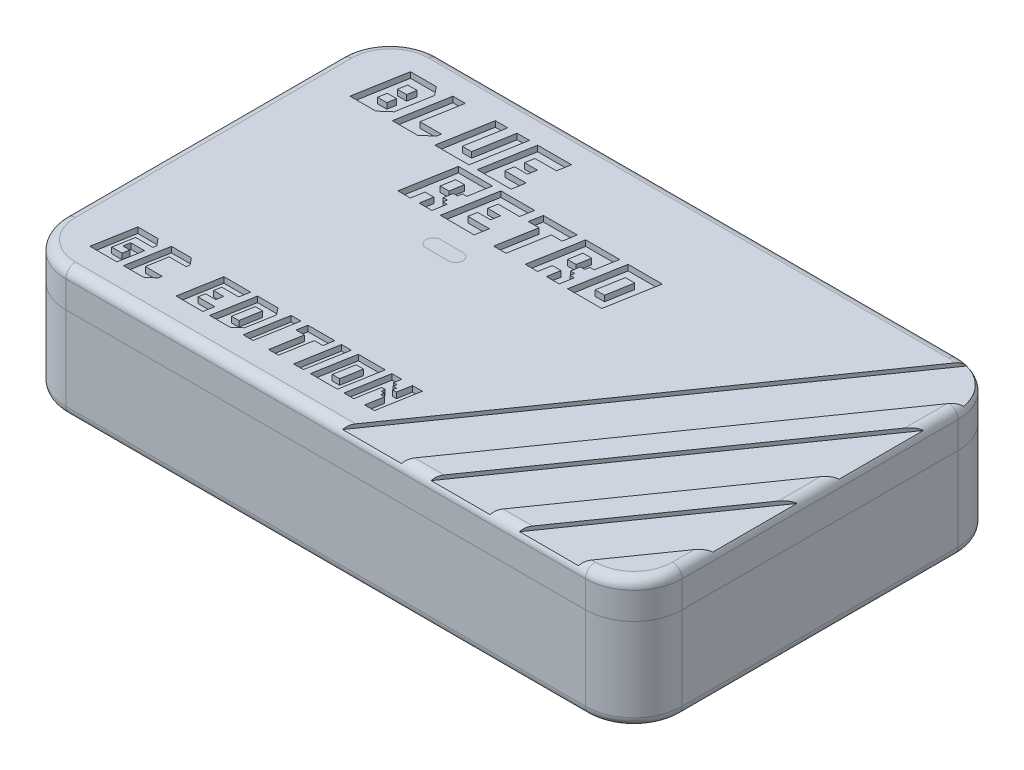
from build123d import *

# Parameters (mm, degrees)
SKETCH1_R                                   = 2
BOSS_EXTRUDE1_DEPTH                         = 0.8
SKETCH2_W                                   = 4
SKETCH2_H                                   = 1.5
BOSS_EXTRUDE2_DEPTH                         = 1
SKETCH3_W                                   = 48.25
SKETCH3_H                                   = 25.72
BOSS_EXTRUDE3_DEPTH                         = 4.15
SKETCH4_W                                   = 2
SKETCH4_H                                   = 5
CUT_EXTRUDE1_DEPTH                          = 0.1
SKETCH9_W                                   = 17.77
SKETCH9_H                                   = 15.77
BOSS_EXTRUDE8_DEPTH                         = 3.2
BOX_SHAPE_DEPTH                             = 4.8
BOX_SHAPE_DEPTH_BACK                        = 12.250000074
SKETCH5_W                                   = 81
SKETCH5_H                                   = 48.970000064
CORNER_FILLETS_R                            = 6.35
TOP_SHELL_T                                 = -2
BOTTOM_SHELL_T                              = -2
PCB_BOSS_HORIZONTAL_DEPTH                   = 1
PCB_BOSS_HORIZONTAL_2_DEPTH                 = 1
PCB_BOSS_VERTICAL_PATTERN_1_COUNT           = 2
PCB_BOSS_VERTICAL_PATTERN_1_ANGLE           = 90
PCB_BOSS_VERTICAL_PATTERN_2_COUNT           = 2
PCB_BOSS_VERTICAL_PATTERN_2_ANGLE           = 90
SKETCH7_R                                   = 2.45
SKETCH7_R_2                                 = 1.95
PCB_BOSS_EDGE_BREAK_DEPTH                   = 90.902188001
SKETCH8_R                                   = 3
SKETCH8_R_2                                 = 2
PCB_TOP_CATCH_DEPTH                         = 3.5
PCB_TOP_CATCH_2_DEPTH                       = 3.5
PCB_TOP_CATCH_3_DEPTH                       = 3.5
PCB_TOP_CATCH_4_DEPTH                       = 3.5
BOSS_NOTCH_FOR_ESP32_REACH                  = 90.547
SKETCH10_W                                  = 3.446348772
SKETCH10_H                                  = 43.18
SHORT_SIDE_SNAPFIT_FEMALE_DEPTH             = 19.05
LONG_SIDE_SNAPFIT_FEMALE_DEPTH              = 19.05
SHORT_SIDE_SNAPFIT_MALE_DEPTH               = 18.415
LONG_SIDE_SNAPFIT_MALE_DEPTH                = 18.415
SKETCH15_R                                  = 1.905
CORD_HOLES_DEPTH                            = 3
CORD_HOLE_FILLET_BOTTOM_R                   = 1
CORD_HOLE_FILLET_TOP_R                      = 1
SKETCH16_W                                  = 5.7277
SKETCH16_H                                  = 2.639081829
SNAPFIT_MALE_REMOVAL_FOR_CORD_HOLES_DEPTH   = 91.007574303
SNAPFIT_FEMALE_REMOVAL_FOR_CORD_HOLES_REACH = 93.023
LED_HOLE_DEPTH                              = 2
TEXT_CUT_DEPTH                              = 0.75
TOP_EDGE_FILLET_R                           = 1.27
R2_DIAG_CUT_LINES_DEPTH                     = 0.500000016
BOTTOM_EDGE_FILLET_R                        = 1.27
SKETCH21_R                                  = 0.75
PLAYER_NUMBER_CUT_DEPTH                     = 1
LED_DIFFUSER_MOCK_DEPTH                     = 1


with BuildPart() as part:
    # Sketch1 → Boss-Extrude1 (new, symmetric)
    with BuildSketch(Plane(origin=(0, 0, 0), x_dir=(1, 0, 0), z_dir=(0, 1, 0))):
        with BuildLine():
            Line((5, 0), (68, 0))
            ThreePointArc((68, 0), (71.535533906, 1.464466094), (73, 5))
            Line((73, 5), (73, 24))
            ThreePointArc((73, 24), (71.535533906, 27.535533906), (68, 29))
            Line((68, 29), (5, 29))
            ThreePointArc((5, 29), (1.464466094, 27.535533906), (0, 24))
            Line((0, 24), (0, 5))
            ThreePointArc((0, 5), (1.464466094, 1.464466094), (5, 0))
        make_face()
        with Locations(Location((4, 4, 0), (0, 0, 270))):
            Circle(SKETCH1_R, mode=Mode.SUBTRACT)
        with Locations(Location((4, 25, 0), (0, 0, 270))):
            Circle(SKETCH1_R, mode=Mode.SUBTRACT)
        with Locations(Location((69, 25, 0), (0, 0, 270))):
            Circle(SKETCH1_R, mode=Mode.SUBTRACT)
        with Locations(Location((69, 4, 0), (0, 0, 270))):
            Circle(SKETCH1_R, mode=Mode.SUBTRACT)
    extrude(amount=BOSS_EXTRUDE1_DEPTH, both=True)

    # Sketch2 → Boss-Extrude2 (add)
    with BuildSketch(Plane(origin=(0, 0.8, 0), x_dir=(1, 0, 0), z_dir=(0, 1, 0))):
        with Locations((25.24, 22.87)):
            Rectangle(SKETCH2_W, SKETCH2_H)
    extrude(amount=BOSS_EXTRUDE2_DEPTH)

    # Sketch3 → Boss-Extrude3 (add)
    with BuildSketch(Plane.XZ.offset(0.8)):
        with Locations((31.67, -14.24)):
            Rectangle(SKETCH3_W, SKETCH3_H)
    extrude(amount=BOSS_EXTRUDE3_DEPTH)

    # Sketch4 → Cut-Extrude1 (cut)
    with BuildSketch(Plane(origin=(0, 0.8, 0), x_dir=(1, 0, 0), z_dir=(0, 1, 0))):
        with Locations((38.02, 14.24)):
            Rectangle(SKETCH4_W, SKETCH4_H)
        with Locations((43.1, 14.24)):
            Rectangle(SKETCH4_W, SKETCH4_H)
        with Locations((48.18, 14.24)):
            Rectangle(SKETCH4_W, SKETCH4_H)
        with Locations((53.26, 14.24)):
            Rectangle(SKETCH4_W, SKETCH4_H)
        with Locations((58.42, 24.4)):
            Rectangle(SKETCH4_W, SKETCH4_H)
        with Locations((58.42, 11.7)):
            Rectangle(SKETCH4_W, SKETCH4_H)
        with Locations((58.42, 18.05)):
            Rectangle(SKETCH4_W, SKETCH4_H)
        with Locations((58.42, 5.35)):
            Rectangle(SKETCH4_W, SKETCH4_H)
        with Locations((63.34, 24.4)):
            Rectangle(SKETCH4_W, SKETCH4_H)
        with Locations((63.34, 11.7)):
            Rectangle(SKETCH4_W, SKETCH4_H)
        with Locations((63.34, 18.05)):
            Rectangle(SKETCH4_W, SKETCH4_H)
        with Locations((63.34, 5.35)):
            Rectangle(SKETCH4_W, SKETCH4_H)
    extrude(amount=-CUT_EXTRUDE1_DEPTH, mode=Mode.SUBTRACT)

    # Sketch9 → Boss-Extrude8 (add)
    with BuildSketch(Plane.XZ.offset(4.95)):
        with Locations((23.43, -14.24)):
            Rectangle(SKETCH9_W, SKETCH9_H)
    extrude(amount=BOSS_EXTRUDE8_DEPTH)


with BuildPart() as body_2:
    # Sketch5 → Box Shape (new, two sides: drawn at the far end of the back side and taken through both)
    with BuildSketch(Plane(origin=(0, 0, 0), x_dir=(1, 0, 0), z_dir=(0, 1, 0)).offset(-BOX_SHAPE_DEPTH_BACK)):
        with Locations((36.5, 20.485000032)):
            Rectangle(SKETCH5_W, SKETCH5_H)
    extrude(amount=BOX_SHAPE_DEPTH + BOX_SHAPE_DEPTH_BACK)

    # Corner Fillets
    corner_fillets_edges = [body_2.edges().sort_by_distance(p)[0] for p in [
        (-4, -3.725000037, -44.970000064),
        (77, -3.725000037, -44.970000064),
        (77, -3.725000037, 4),
        (-4, -3.725000037, 4),
    ]]
    fillet(corner_fillets_edges, radius=CORNER_FILLETS_R)


with BuildPart() as body_3:
    # Top Bottom Split: the piece on the far side of the plane
    add(body_2.part)
    split(bisect_by=Plane.ZX, keep=Keep.BOTTOM)

    # Bottom Shell
    bottom_shell_openings = [body_3.faces().sort_by_distance(p)[0] for p in [
        (36.5, 0, -20.485000032),
    ]]
    offset(amount=BOTTOM_SHELL_T, openings=bottom_shell_openings, kind=Kind.INTERSECTION)


with BuildPart() as body_2_1:
    add(body_2.part)

    # Top Bottom Split
    split(bisect_by=Plane.ZX, keep=Keep.TOP)

    # Top Shell
    top_shell_openings = [body_2_1.faces().sort_by_distance(p)[0] for p in [
        (36.5, 0, -20.485000032),
    ]]
    offset(amount=TOP_SHELL_T, openings=top_shell_openings, kind=Kind.INTERSECTION)


with BuildPart() as body_4:
    # Sketch6 → PCB Boss Horizontal (new, symmetric)
    with BuildSketch(Plane.XY.offset(-4.000000128)):
        Polygon((71.75, -0.8), (74.715, -10.250000074), (63.285, -10.250000074), (66.25, -0.8), (67.25, -0.8), (67.25, 1.8), (70.75, 1.8), (70.75, -0.8), align=None)
    extrude(amount=PCB_BOSS_HORIZONTAL_DEPTH, both=True)


with BuildPart() as body_5:
    # Sketch6 → PCB Boss Horizontal 2 (new, symmetric)
    with BuildSketch(Plane.XY.offset(-4.000000128)):
        Polygon((2.25, -0.8), (1.25, -0.8), (-1.715, -10.250000074), (9.715, -10.250000074), (6.75, -0.8), (5.75, -0.8), (5.75, 1.8), (2.25, 1.8), align=None)
    extrude(amount=PCB_BOSS_HORIZONTAL_2_DEPTH, both=True)


with BuildPart() as pcb_boss_vertical_pattern_1_1:
    # PCB Boss Vertical Pattern 1: pattern copy
    add(body_4.part.rotate(Axis((69, 0, -4), (0, 1, 0)), 1 * PCB_BOSS_VERTICAL_PATTERN_1_ANGLE / (PCB_BOSS_VERTICAL_PATTERN_1_COUNT - 1)))


with BuildPart() as pcb_boss_vertical_pattern_2_1:
    # PCB Boss Vertical Pattern 2: pattern copy
    add(body_5.part.rotate(Axis((4, 0, -4), (0, 1, 0)), 1 * PCB_BOSS_VERTICAL_PATTERN_2_ANGLE / (PCB_BOSS_VERTICAL_PATTERN_2_COUNT - 1)))


with BuildPart() as body_8:
    # PCB Boss Mirror: mirrored copy
    add(pcb_boss_vertical_pattern_1_1.part.mirror(Plane(origin=(0, 0, -14.5), x_dir=(1, 0, 0), z_dir=(0, 0, -1))))


with BuildPart() as body_9:
    # PCB Boss Mirror 2: mirrored copy
    add(body_4.part.mirror(Plane(origin=(0, 0, -14.5), x_dir=(1, 0, 0), z_dir=(0, 0, -1))))


with BuildPart() as body_10:
    # PCB Boss Mirror 3: mirrored copy
    add(pcb_boss_vertical_pattern_2_1.part.mirror(Plane(origin=(0, 0, -14.5), x_dir=(1, 0, 0), z_dir=(0, 0, -1))))


with BuildPart() as body_11:
    # PCB Boss Mirror 4: mirrored copy
    add(body_5.part.mirror(Plane(origin=(0, 0, -14.5), x_dir=(1, 0, 0), z_dir=(0, 0, -1))))


with BuildPart() as body_4_1:
    add(body_4.part)

    # Bottom Combine: union body 5, PCB Boss Vertical Pattern 2_1, PCB Boss Vertical Pattern 1_1, body 3, body 9, body 8, body 11, body 10
    add(body_5.part)
    add(pcb_boss_vertical_pattern_2_1.part)
    add(pcb_boss_vertical_pattern_1_1.part)
    add(body_3.part)
    add(body_9.part)
    add(body_8.part)
    add(body_11.part)
    add(body_10.part)

    # Sketch7 → PCB Boss Edge Break (cut, through all)
    # profile 1 of 4: a face of its own
    with BuildSketch(Plane(origin=(0, -0.8, 0), x_dir=(1, 0, 0), z_dir=(0, 1, 0))):
        with Locations((69, 25)):
            Circle(SKETCH7_R)
        with Locations((69, 25)):
            Circle(SKETCH7_R_2, mode=Mode.SUBTRACT)
    # profile 2 of 4: a face of its own
    with BuildSketch(Plane(origin=(0, -0.8, 0), x_dir=(1, 0, 0), z_dir=(0, 1, 0))):
        with Locations((69, 4)):
            Circle(SKETCH7_R)
        with Locations((69, 4)):
            Circle(SKETCH7_R_2, mode=Mode.SUBTRACT)
    # profile 3 of 4: a face of its own
    with BuildSketch(Plane(origin=(0, -0.8, 0), x_dir=(1, 0, 0), z_dir=(0, 1, 0))):
        with Locations((4, 4)):
            Circle(SKETCH7_R)
        with Locations((4, 4)):
            Circle(SKETCH7_R_2, mode=Mode.SUBTRACT)
    # profile 4 of 4: a face of its own
    with BuildSketch(Plane(origin=(0, -0.8, 0), x_dir=(1, 0, 0), z_dir=(0, 1, 0))):
        with Locations((4, 25)):
            Circle(SKETCH7_R)
        with Locations((4, 25)):
            Circle(SKETCH7_R_2, mode=Mode.SUBTRACT)
    extrude(amount=PCB_BOSS_EDGE_BREAK_DEPTH, mode=Mode.SUBTRACT)

    # Boss Notch for ESP32: up to this face of the body (flat: up to its plane)
    boss_notch_for_esp32_end = Plane(body_4_1.part.faces().sort_by_distance((6.654009501, -5.8812231, -25.999999872))[0])
    # Sketch10 → Boss Notch for ESP32 (cut, up to the picked face)
    with BuildSketch(Plane.XY.offset(-3.000000128), mode=Mode.PRIVATE) as boss_notch_for_esp32_sk1:
        with Locations((64.231825614, 15.39)):
            Rectangle(SKETCH10_W, SKETCH10_H)
    boss_notch_for_esp32_tool1 = split(extrude(boss_notch_for_esp32_sk1.sketch, amount=-BOSS_NOTCH_FOR_ESP32_REACH, mode=Mode.PRIVATE), bisect_by=boss_notch_for_esp32_end, keep=Keep.BOTH, mode=Mode.PRIVATE)
    # Sketch10 → Boss Notch for ESP32 (cut, up to the picked face)
    with BuildSketch(Plane.XY.offset(-3.000000128), mode=Mode.PRIVATE) as boss_notch_for_esp32_sk2:
        with Locations((8.768174386, 15.39)):
            Rectangle(SKETCH10_W, SKETCH10_H)
    boss_notch_for_esp32_tool2 = split(extrude(boss_notch_for_esp32_sk2.sketch, amount=-BOSS_NOTCH_FOR_ESP32_REACH, mode=Mode.PRIVATE), bisect_by=boss_notch_for_esp32_end, keep=Keep.BOTH, mode=Mode.PRIVATE)
    add(boss_notch_for_esp32_tool1.solids().sort_by(Axis((64.231826, 15.39, -3), (0, 0, -1)))[0], mode=Mode.SUBTRACT)
    add(boss_notch_for_esp32_tool2.solids().sort_by(Axis((8.768174, 15.39, -3), (0, 0, -1)))[0], mode=Mode.SUBTRACT)

    # Sketch11 → Short Side Snapfit Female (cut, symmetric)
    with BuildSketch(Plane(origin=(0, 0, -20.485000032), x_dir=(-1, 0, 0), z_dir=(0, 0, -1))):
        with BuildLine():
            Line((-75, 0), (-75, -3))
            Line((-75, -3), (-75.25, -3))
            ThreePointArc((-75.25, -3), (-75.999742994, -2.269632711), (-75.289251967, -1.501027849))
            Line((-75.289251967, -1.501027849), (-75.367917503, 0))
            Line((-75.367917503, 0), (-75, 0))
        make_face()
    short_side_snapfit_female = extrude(amount=SHORT_SIDE_SNAPFIT_FEMALE_DEPTH, both=True, mode=Mode.SUBTRACT)

    # Short Side Snapfit Mirror: Short Side Snapfit Female across plane
    add(short_side_snapfit_female.mirror(Plane.ZY.offset(-36.5)), mode=Mode.SUBTRACT)

    # Sketch12 → Long Side Snapfit Female (cut, symmetric)
    with BuildSketch(Plane.ZY.offset(-36.5)):
        with BuildLine():
            Line((2.367449648, 0), (2, 0))
            Line((2, 0), (2, -3))
            Line((2, -3), (2.25, -3))
            ThreePointArc((2.25, -3), (2.999749072, -2.269399183), (2.288785386, -1.501003542))
            Line((2.288785386, -1.501003542), (2.367449648, 0))
        make_face()
    long_side_snapfit_female = extrude(amount=LONG_SIDE_SNAPFIT_FEMALE_DEPTH, both=True, mode=Mode.SUBTRACT)

    # Long Side Snapfit Female Mirror: Long Side Snapfit Female across plane
    add(long_side_snapfit_female.mirror(Plane(origin=(0, 0, -20.485000032), x_dir=(1, 0, 0), z_dir=(0, 0, -1))), mode=Mode.SUBTRACT)


with BuildPart() as body_4_2:
    # Sketch8 → PCB Top Catch (new body)
    with BuildSketch(Plane(origin=(0, 0.8, 0), x_dir=(1, 0, 0), z_dir=(0, 1, 0))):
        with Locations(Location((69, 4, 0), (0, 0, 270))):
            Circle(SKETCH8_R)
        with Locations(Location((69, 4, 0), (0, 0, 270))):
            Circle(SKETCH8_R_2, mode=Mode.SUBTRACT)
    extrude(amount=PCB_TOP_CATCH_DEPTH)


with BuildPart() as body_5_2:
    # Sketch8 → PCB Top Catch 2 (new body)
    with BuildSketch(Plane(origin=(0, 0.8, 0), x_dir=(1, 0, 0), z_dir=(0, 1, 0))):
        with Locations(Location((69, 25, 0), (0, 0, 270))):
            Circle(SKETCH8_R)
        with Locations(Location((69, 25, 0), (0, 0, 270))):
            Circle(SKETCH8_R_2, mode=Mode.SUBTRACT)
    extrude(amount=PCB_TOP_CATCH_2_DEPTH)


with BuildPart() as body_6:
    # Sketch8 → PCB Top Catch 3 (new body)
    with BuildSketch(Plane(origin=(0, 0.8, 0), x_dir=(1, 0, 0), z_dir=(0, 1, 0))):
        with Locations(Location((4, 25, 0), (0, 0, 270))):
            Circle(SKETCH8_R)
        with Locations(Location((4, 25, 0), (0, 0, 270))):
            Circle(SKETCH8_R_2, mode=Mode.SUBTRACT)
    extrude(amount=PCB_TOP_CATCH_3_DEPTH)


with BuildPart() as body_7:
    # Sketch8 → PCB Top Catch 4 (new body)
    with BuildSketch(Plane(origin=(0, 0.8, 0), x_dir=(1, 0, 0), z_dir=(0, 1, 0))):
        with Locations(Location((4, 4, 0), (0, 0, 270))):
            Circle(SKETCH8_R)
        with Locations(Location((4, 4, 0), (0, 0, 270))):
            Circle(SKETCH8_R_2, mode=Mode.SUBTRACT)
    extrude(amount=PCB_TOP_CATCH_4_DEPTH)

    # Top Combine: union body 4 2, body 5 2, body 6, body 2
    add(body_4_2.part)
    add(body_5_2.part)
    add(body_6.part)
    add(body_2_1.part)


with BuildPart() as body_4_3:
    # Sketch13 → Short Side Snapfit Male (new, symmetric)
    with BuildSketch(Plane(origin=(0, 0, -20.485000032), x_dir=(-1, 0, 0), z_dir=(0, 0, -1))):
        with BuildLine():
            Line((-73.311386027, 2.8), (-75.317986027, 2.8))
            Line((-75.317986027, 2.8), (-75.317986027, 0.002616798))
            Line((-75.317986027, 0.002616798), (-75.236610116, -1.550128075))
            ThreePointArc((-75.236610116, -1.550128075), (-75.94996798, -2.243304752), (-75.25, -2.95))
            Line((-75.25, -2.95), (-73.98, -2.95))
            Line((-73.98, -2.95), (-73.311386027, 2.8))
        make_face()
    extrude(amount=SHORT_SIDE_SNAPFIT_MALE_DEPTH, both=True)


with BuildPart() as body_5_3:
    # Short Side Snapfit Male Mirror: mirrored copy
    add(body_4_3.part.mirror(Plane.ZY.offset(-36.5)))


with BuildPart() as body_6_2:
    # Sketch14 → Long Side Snapfit Male (new, symmetric)
    with BuildSketch(Plane.ZY.offset(-36.5)):
        with BuildLine():
            Line((0.98, -2.95), (0.310918171, 2.8))
            Line((0.310918171, 2.8), (2.317518171, 2.8))
            Line((2.317518171, 2.8), (2.317518171, 0.002616798))
            Line((2.317518171, 0.002616798), (2.236141783, -1.550137192))
            ThreePointArc((2.236141783, -1.550137192), (2.949965701, -2.243070552), (2.25, -2.95))
            Line((2.25, -2.95), (0.98, -2.95))
        make_face()
    extrude(amount=LONG_SIDE_SNAPFIT_MALE_DEPTH, both=True)


with BuildPart() as body_7_2:
    # Long Side Snapfit Male Mirror: mirrored copy
    add(body_6_2.part.mirror(Plane(origin=(0, 0, -20.485000032), x_dir=(1, 0, 0), z_dir=(0, 0, -1))))


with BuildPart() as body_6_2_1:
    add(body_6_2.part)

    # Top Combine 2: union body 5 3, body 4 3, body 7, body 7 2
    add(body_5_3.part)
    add(body_4_3.part)
    add(body_7.part)
    add(body_7_2.part)


with BuildPart() as cord_holes_tool:
    # Sketch15 → Cord Holes (new body)
    with BuildSketch(Plane(origin=(0, 0, -44.970000064), x_dir=(-1, 0, 0), z_dir=(0, 0, -1))):
        with Locations((-60.3125, 0)):
            Circle(SKETCH15_R)
        with Locations((-44.4375, 0)):
            Circle(SKETCH15_R)
        with Locations((-28.5625, 0)):
            Circle(SKETCH15_R)
        with Locations((-12.6875, 0)):
            Circle(SKETCH15_R)
    extrude(amount=-CORD_HOLES_DEPTH)


with BuildPart() as body_4_4:
    add(body_4_1.part)

    # Cord Holes: cut by cord_holes_tool
    add(cord_holes_tool.part, mode=Mode.SUBTRACT)

    # Cord Hole Fillet Bottom
    cord_hole_fillet_bottom_edges = [body_4_4.edges().sort_by_distance(p)[0] for p in [
        (60.3125, -1.905, -44.970000064),
        (44.4375, -1.905, -44.970000064),
        (28.5625, -1.905, -44.970000064),
        (12.6875, -1.905, -44.970000064),
    ]]
    fillet(cord_hole_fillet_bottom_edges, radius=CORD_HOLE_FILLET_BOTTOM_R)


with BuildPart() as body_6_2_2:
    add(body_6_2_1.part)

    # Cord Holes: cut by cord_holes_tool
    add(cord_holes_tool.part, mode=Mode.SUBTRACT)

    # Cord Hole Fillet Top
    cord_hole_fillet_top_edges = [body_6_2_2.edges().sort_by_distance(p)[0] for p in [
        (60.3125, 1.905, -44.970000064),
        (44.4375, 1.905, -44.970000064),
        (28.5625, 1.905, -44.970000064),
        (12.6875, 1.905, -44.970000064),
    ]]
    fillet(cord_hole_fillet_top_edges, radius=CORD_HOLE_FILLET_TOP_R)

    # Sketch16 → Snapfit Male Removal for Cord Holes (cut, through all)
    with BuildSketch(Plane.XZ):
        with Locations((44.43115, -42.600459149)):
            Rectangle(SKETCH16_W, SKETCH16_H)
        with Locations((28.56885, -42.600459149)):
            Rectangle(SKETCH16_W, SKETCH16_H)
    extrude(amount=SNAPFIT_MALE_REMOVAL_FOR_CORD_HOLES_DEPTH, mode=Mode.SUBTRACT)

    # Sketch18 → LED Hole (cut)
    with BuildSketch(Plane(origin=(0, 4.8, 0), x_dir=(1, 0, 0), z_dir=(0, 1, 0))):
        with BuildLine():
            Line((23.761454304, 23.817187834), (26.718545696, 23.817187834))
            ThreePointArc((26.718545696, 23.817187834), (27.66573353, 22.87), (26.718545696, 21.922812166))
            Line((26.718545696, 21.922812166), (23.761454304, 21.922812166))
            ThreePointArc((23.761454304, 21.922812166), (22.81426647, 22.87), (23.761454304, 23.817187834))
        make_face()
    extrude(amount=-LED_HOLE_DEPTH, mode=Mode.SUBTRACT)

    # Sketch20 → Text Cut (cut)
    # profile 1 of 18: a face of its own
    with BuildSketch(Plane(origin=(0, 4.8, 0), x_dir=(1, 0, 0), z_dir=(0, 1, 0))):
        Polygon((6.184089057, 35.313550471), (6.979195308, 39.82297185), (6.53407372, 40.385836725), (6.541530377, 40.385836725), (6.088953221, 40.9487016), (2.688902699, 40.9487016), (1.496522743, 34.186155093), (4.896573265, 34.186155093), align=None)
        Polygon((3.620549114, 36.970449128), (4.843139153, 36.970449128), (4.650385925, 35.87725742), (3.427795885, 35.87725742), align=None, mode=Mode.SUBTRACT)
        Polygon((5.040612571, 38.090413994), (3.818022532, 38.090413994), (4.022904675, 39.252396498), (5.245494715, 39.252396498), align=None, mode=Mode.SUBTRACT)
    # profile 2 of 18: a face of its own
    with BuildSketch(Plane(origin=(0, 4.8, 0), x_dir=(1, 0, 0), z_dir=(0, 1, 0))):
        Polygon((11.726773932, 35.316993933), (11.826018826, 35.879858808), (9.003983974, 35.879858808), (9.898449502, 40.952794319), (8.265353323, 40.952794319), (7.071793592, 34.183553705), (10.401194874, 34.183553705), align=None)
    # profile 3 of 18: a face of its own
    with BuildSketch(Plane(origin=(0, 4.8, 0), x_dir=(1, 0, 0), z_dir=(0, 1, 0))):
        Polygon((16.69676901, 40.952794319), (15.801844862, 35.87725742), (14.579254823, 35.87725742), (15.474178971, 40.952794319), (13.841082792, 40.952794319), (12.64798168, 34.186155093), (17.136764078, 34.186155093), (18.329865189, 40.952794319), align=None)
    # profile 4 of 18: a face of its own
    with BuildSketch(Plane(origin=(0, 4.8, 0), x_dir=(1, 0, 0), z_dir=(0, 1, 0))):
        Polygon((22.969767286, 35.879858808), (20.155442911, 35.879858808), (20.34773752, 36.970449128), (22.036332145, 36.970449128), (22.233805563, 38.090413994), (20.545210938, 38.090413994), (20.750551701, 39.254997885), (23.564876076, 39.254997885), (23.863053039, 40.946100213), (19.415632485, 40.946100213), (18.223252529, 34.183553705), (22.670673083, 34.183553705), align=None)
    # profile 5 of 18: a face of its own
    with BuildSketch(Plane(origin=(0, 4.8, 0), x_dir=(1, 0, 0), z_dir=(0, 1, 0))):
        Polygon((16.61768545, 33.326100213), (15.425764114, 26.566155093), (17.058860293, 26.566155093), (17.348383394, 28.208174205), (18.499581251, 28.208174205), (18.210058149, 26.566155093), (19.898001338, 26.566155093), (20.196178301, 28.25725742), (19.633313426, 28.25725742), (19.724506874, 28.774457486), (19.161641999, 28.774457486), (19.358602329, 29.891509408), (19.921467204, 29.891509408), (20.023454014, 30.469924873), (20.586318889, 30.469924873), (21.089922674, 33.326100213), align=None)
        Polygon((17.646560357, 29.899276533), (17.952604666, 31.634997885), (19.103802523, 31.634997885), (18.797758214, 29.899276533), align=None, mode=Mode.SUBTRACT)
    # profile 6 of 18: a face of its own
    with BuildSketch(Plane(origin=(0, 4.8, 0), x_dir=(1, 0, 0), z_dir=(0, 1, 0))):
        Polygon((25.747549719, 28.259858808), (22.933225345, 28.259858808), (23.125519953, 29.350449128), (24.814114578, 29.350449128), (25.011587996, 30.470413994), (23.322993371, 30.470413994), (23.528334135, 31.634997885), (26.342658509, 31.634997885), (26.640835473, 33.326100213), (22.193414919, 33.326100213), (21.001034962, 26.563553705), (25.448455516, 26.563553705), align=None)
    # profile 7 of 18: a face of its own
    with BuildSketch(Plane(origin=(0, 4.8, 0), x_dir=(1, 0, 0), z_dir=(0, 1, 0))):
        Polygon((32.241101647, 33.326100213), (27.785969525, 33.326100213), (27.487792562, 31.634997885), (28.898809989, 31.634997885), (28.00388584, 26.559460986), (29.636983109, 26.559460986), (30.531907257, 31.634997885), (31.942924683, 31.634997885), align=None)
    # profile 8 of 18: a face of its own
    with BuildSketch(Plane(origin=(0, 4.8, 0), x_dir=(1, 0, 0), z_dir=(0, 1, 0))):
        Polygon((33.344873856, 33.326100213), (32.152952519, 26.566155093), (33.786048699, 26.566155093), (34.0755718, 28.208174205), (35.226769657, 28.208174205), (34.937246555, 26.566155093), (36.625189744, 26.566155093), (36.923366707, 28.25725742), (36.360501832, 28.25725742), (36.45169528, 28.774457486), (35.888830405, 28.774457486), (36.085790735, 29.891509408), (36.64865561, 29.891509408), (36.750642419, 30.469924873), (37.313507294, 30.469924873), (37.81711108, 33.326100213), align=None)
        Polygon((34.373748763, 29.899276533), (34.679793072, 31.634997885), (35.830990928, 31.634997885), (35.52494662, 29.899276533), align=None, mode=Mode.SUBTRACT)
    # profile 9 of 18: a face of its own
    with BuildSketch(Plane(origin=(0, 4.8, 0), x_dir=(1, 0, 0), z_dir=(0, 1, 0))):
        Polygon((38.920603324, 33.326100213), (37.728681988, 26.566155093), (42.217464386, 26.566155093), (43.409385722, 33.326100213), align=None)
        Polygon((40.25552254, 31.634997885), (41.47811258, 31.634997885), (40.88254517, 28.25725742), (39.65995513, 28.25725742), align=None, mode=Mode.SUBTRACT)
    # profile 10 of 18: a face of its own
    with BuildSketch(Plane(origin=(0, 4.8, 0), x_dir=(1, 0, 0), z_dir=(0, 1, 0))):
        Polygon((5.590772397, 3.099702695), (3.78854536, 3.099702695), (3.632212237, 2.213063843), (4.543236556, 2.213063843), (4.39064025, 1.347620407), (3.024108084, 1.347620407), (3.49559895, 4.021664942), (5.753333835, 4.021664942), (5.832018272, 4.467926044), (5.098187879, 5.360454285), (2.438787904, 5.360454285), (1.495183513, 0.008831064), (5.045786206, 0.008831064), align=None)
    # profile 11 of 18: a face of its own
    with BuildSketch(Plane(origin=(0, 4.8, 0), x_dir=(1, 0, 0), z_dir=(0, 1, 0))):
        Polygon((9.587186532, 0.899304185), (9.666234044, 1.347620407), (7.438227247, 1.347620407), (7.909355039, 4.01960551), (10.137361836, 4.01960551), (10.215930711, 4.465206869), (9.482942028, 5.362513716), (6.853270141, 5.362513716), (5.909302676, 0.008831064), (8.538974562, 0.008831064), align=None)
    # profile 12 of 18: a face of its own
    with BuildSketch(Plane(origin=(0, 4.8, 0), x_dir=(1, 0, 0), z_dir=(0, 1, 0))):
        Polygon((16.573195859, 1.349679839), (14.345189062, 1.349679839), (14.497422294, 2.213063843), (15.834226372, 2.213063843), (15.990559495, 3.099702695), (14.653755416, 3.099702695), (14.816316854, 4.021664942), (17.044323651, 4.021664942), (17.280380413, 5.360454285), (13.759505808, 5.360454285), (12.815538343, 0.006771632), (16.336412948, 0.006771632), align=None)
    # profile 13 of 18: a face of its own
    with BuildSketch(Plane(origin=(0, 4.8, 0), x_dir=(1, 0, 0), z_dir=(0, 1, 0))):
        Polygon((20.941010578, 0.901352406), (21.569393407, 4.465206869), (20.865694708, 5.362513716), (18.173988045, 5.362513716), (17.23002058, 0.008831064), (19.921727243, 0.008831064), align=None)
        Polygon((19.230072943, 4.01960551), (20.197956724, 4.01960551), (19.726828932, 1.347620407), (18.758945151, 1.347620407), align=None, mode=Mode.SUBTRACT)
    # profile 14 of 18: a face of its own
    with BuildSketch(Plane(origin=(0, 4.8, 0), x_dir=(1, 0, 0), z_dir=(0, 1, 0))):
        Polygon((22.588678122, 5.365753786), (21.643205754, 0.003531563), (22.936073562, 0.003531563), (23.88154593, 5.365753786), align=None)
    # profile 15 of 18: a face of its own
    with BuildSketch(Plane(origin=(0, 4.8, 0), x_dir=(1, 0, 0), z_dir=(0, 1, 0))):
        Polygon((28.337929152, 5.360454285), (24.810949556, 5.360454285), (24.574892794, 4.021664942), (25.691948256, 4.021664942), (24.983466639, 0.003531563), (26.27633531, 0.003531563), (26.984816927, 4.021664942), (28.10187239, 4.021664942), align=None)
    # profile 16 of 18: a face of its own
    with BuildSketch(Plane(origin=(0, 4.8, 0), x_dir=(1, 0, 0), z_dir=(0, 1, 0))):
        Polygon((29.212682806, 5.365753786), (28.267210438, 0.003531563), (29.560078247, 0.003531563), (30.505550615, 5.365753786), align=None)
    # profile 17 of 18: a face of its own
    with BuildSketch(Plane(origin=(0, 4.8, 0), x_dir=(1, 0, 0), z_dir=(0, 1, 0))):
        Polygon((31.42163434, 5.360454285), (30.478029949, 0.008831064), (34.031649347, 0.008831064), (34.975253738, 5.360454285), align=None)
        Polygon((32.478445386, 4.021664942), (33.446329167, 4.021664942), (32.974838301, 1.347620407), (32.00695452, 1.347620407), align=None, mode=Mode.SUBTRACT)
    # profile 18 of 18: a face of its own
    with BuildSketch(Plane(origin=(0, 4.8, 0), x_dir=(1, 0, 0), z_dir=(0, 1, 0))):
        Polygon((38.548497762, 5.359568591), (38.230162042, 3.554135119), (37.714429614, 3.554135119), (37.794787987, 4.009886165), (37.349701485, 4.009886165), (37.42838851, 4.456154166), (36.969174031, 4.456154166), (37.1295553, 5.365753786), (35.836687491, 5.365753786), (34.891215123, 0.003531563), (36.184082931, 0.003531563), (36.733117268, 3.117363961), (37.192331748, 3.117363961), (37.112205363, 2.6629324), (37.557291864, 2.6629324), (37.480934205, 2.229872187), (37.996666633, 2.229872187), (37.60411634, 0.003531563), (38.896985011, 0.003531563), (39.84245738, 5.365753786), align=None)
    extrude(amount=-TEXT_CUT_DEPTH, mode=Mode.SUBTRACT)

    # Top Edge Fillet
    top_edge_fillet_edges = [body_6_2_2.edges().sort_by_distance(p)[0] for p in [
        (36.5, 4.8, -44.970000064),
        (-2.140128061, 4.8, -43.110128125),
        (-4, 4.8, -20.485000032),
        (-2.140128061, 4.8, 2.140128061),
        (36.5, 4.8, 4),
        (75.140128061, 4.8, 2.140128061),
        (77, 4.8, -20.485000032),
        (75.140128061, 4.8, -43.110128125),
    ]]
    fillet(top_edge_fillet_edges, radius=TOP_EDGE_FILLET_R)

    # Sketch23 → R2 Diag Cut Lines (cut)
    with BuildSketch(Plane(origin=(0, 4.8, 0), x_dir=(1, 0, 0), z_dir=(0, 1, 0))):
        with BuildLine():
            Line((46.038104632, -4), (76.847992948, 40.001080587))
            ThreePointArc((76.847992948, 40.001080587), (75.273641591, 42.972520993), (72.402636371, 44.723340604))
            Line((72.402636371, 44.723340604), (38.286185994, -4))
            Line((38.286185994, -4), (46.038104632, -4))
        make_face()
        Polygon((77, 34.682725578), (49.914063952, -4), (57.66598259, -4), (77, 23.611838426), align=None)
        Polygon((77, 7.005507698), (69.293860548, -4), (61.541941909, -4), (77, 18.07639485), align=None)
    extrude(amount=-R2_DIAG_CUT_LINES_DEPTH, mode=Mode.SUBTRACT)


with BuildPart() as body_4_4_1:

    # Sketch17 → Snapfit Female Removal for Cord Holes (new, up to next)
    with BuildSketch(Plane.XY.offset(-42.970000064), mode=Mode.PRIVATE) as snapfit_female_removal_for_cord_holes_sk1:
        with BuildLine():
            Line((26.205, 0), (26.6575, 0))
            ThreePointArc((26.6575, 0), (28.5625, -1.905), (30.4675, 0))
            Line((30.4675, 0), (30.92, 0))
            Line((30.92, 0), (30.92, -3))
            Line((30.92, -3), (26.205, -3))
            Line((26.205, -3), (26.205, 0))
        make_face()
    snapfit_female_removal_for_cord_holes_tool1 = extrude(snapfit_female_removal_for_cord_holes_sk1.sketch, amount=-SNAPFIT_FEMALE_REMOVAL_FOR_CORD_HOLES_REACH, mode=Mode.PRIVATE) - body_4_4.part
    # Sketch17 → Snapfit Female Removal for Cord Holes (new, up to next)
    with BuildSketch(Plane.XY.offset(-42.970000064), mode=Mode.PRIVATE) as snapfit_female_removal_for_cord_holes_sk2:
        with BuildLine():
            Line((42.08, 0), (42.5325, 0))
            ThreePointArc((42.5325, 0), (44.4375, -1.905), (46.3425, 0))
            Line((46.3425, 0), (46.795, 0))
            Line((46.795, 0), (46.795, -3))
            Line((46.795, -3), (42.08, -3))
            Line((42.08, -3), (42.08, 0))
        make_face()
    snapfit_female_removal_for_cord_holes_tool2 = extrude(snapfit_female_removal_for_cord_holes_sk2.sketch, amount=-SNAPFIT_FEMALE_REMOVAL_FOR_CORD_HOLES_REACH, mode=Mode.PRIVATE) - body_4_4.part
    add(snapfit_female_removal_for_cord_holes_tool1.solids().sort_by_distance((28.5625, -1.96679, -42.97))[0])
    add(snapfit_female_removal_for_cord_holes_tool2.solids().sort_by_distance((44.4375, -1.96679, -42.97))[0])


with BuildPart() as body_4_5:
    add(body_4_4.part)

    # Bottom Combine 2: read off the stored shape, not the designer's step
    # Bottom Combine 2: union body 4 4
    add(body_4_4_1.part)

    # Bottom Edge Fillet
    bottom_edge_fillet_edges = [body_4_5.edges().sort_by_distance(p)[0] for p in [
        (-4, -12.250000074, -20.485000032),
        (-2.140128061, -12.250000074, -43.110128125),
        (75.140128061, -12.250000074, -43.110128125),
        (75.140128061, -12.250000074, 2.140128061),
        (-2.140128061, -12.250000074, 2.140128061),
        (36.5, -12.250000074, 4),
        (77, -12.250000074, -20.485000032),
        (36.5, -12.250000074, -44.970000064),
    ]]
    fillet(bottom_edge_fillet_edges, radius=BOTTOM_EDGE_FILLET_R)

    # Sketch21 → Player Number Cut (cut)
    with BuildSketch(Plane(origin=(0, 0, -44.970000064), x_dir=(-1, 0, 0), z_dir=(0, 0, -1))):
        with Locations((-12.6875, -6.35)):
            Circle(SKETCH21_R)
        with Locations((-29.8325, -6.35)):
            Circle(SKETCH21_R)
        with Locations((-27.2925, -6.35)):
            Circle(SKETCH21_R)
        with Locations((-46.9775, -6.35)):
            Circle(SKETCH21_R)
        with Locations((-44.4375, -6.35)):
            Circle(SKETCH21_R)
        with Locations((-41.8975, -6.35)):
            Circle(SKETCH21_R)
        with Locations((-64.1225, -6.35)):
            Circle(SKETCH21_R)
        with Locations((-61.5825, -6.35)):
            Circle(SKETCH21_R)
        with Locations((-59.0425, -6.35)):
            Circle(SKETCH21_R)
        with Locations((-56.5025, -6.35)):
            Circle(SKETCH21_R)
    extrude(amount=-PLAYER_NUMBER_CUT_DEPTH, mode=Mode.SUBTRACT)


with BuildPart() as body_4_5_1:
    # Sketch22 → LED Diffuser Mock (new body)
    with BuildSketch(Plane(origin=(0, 4.8, 0), x_dir=(1, 0, 0), z_dir=(0, 1, 0))):
        with BuildLine():
            Line((23.761454304, 21.922812166), (26.718545696, 21.922812166))
            ThreePointArc((26.718545696, 21.922812166), (27.66573353, 22.87), (26.718545696, 23.817187834))
            Line((26.718545696, 23.817187834), (23.761454304, 23.817187834))
            ThreePointArc((23.761454304, 23.817187834), (22.81426647, 22.87), (23.761454304, 21.922812166))
        make_face()
    extrude(amount=-LED_DIFFUSER_MOCK_DEPTH)


solid = Compound([part.part, body_6_2_2.part, body_4_5.part, body_4_5_1.part])
